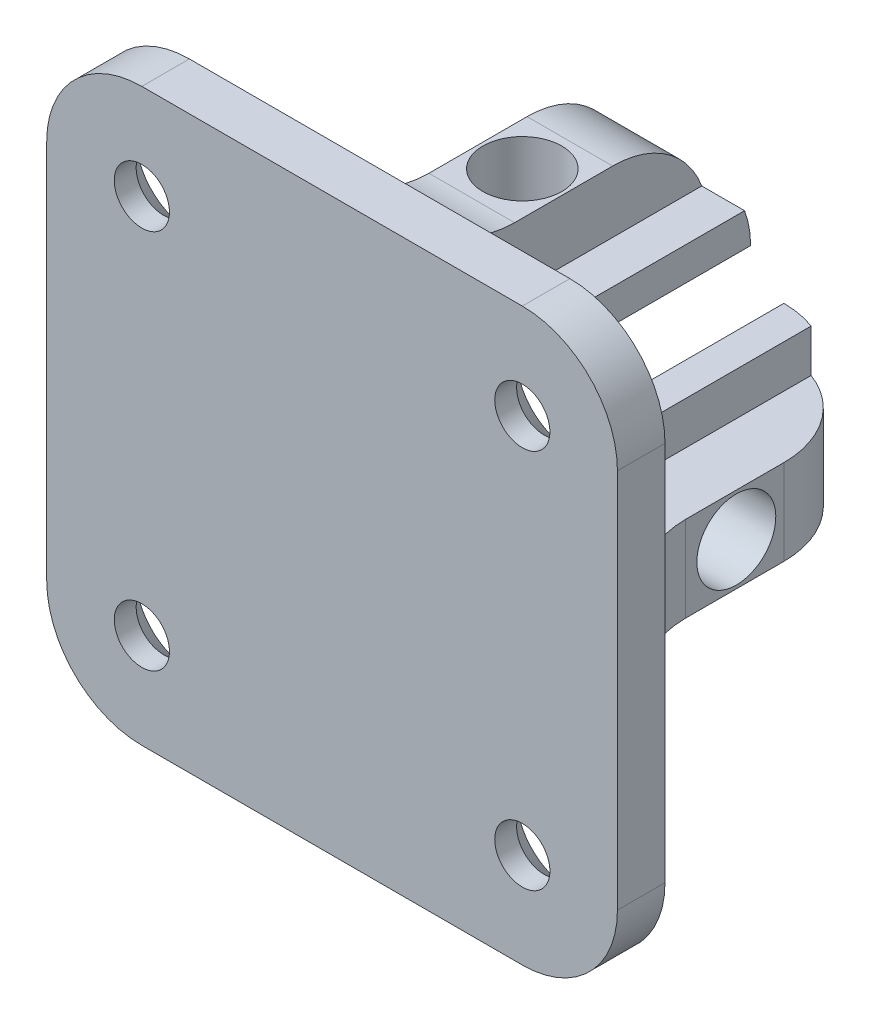
from build123d import *

# Parameters (mm, degrees)
SKETCH1_W                                            = 60
SKETCH1_H                                            = 60
BOSS_EXTRUDE1_DEPTH                                  = 5
CSK_FOR_M5_HEX_SOCKET_COUNTERSUNK_CAP_SC_D           = 5.8
CSK_FOR_M5_HEX_SOCKET_COUNTERSUNK_CAP_SC_DEPTH       = 5
CSK_FOR_M5_HEX_SOCKET_COUNTERSUNK_CAP_SC_CSINK_D     = 11.2
CSK_FOR_M5_HEX_SOCKET_COUNTERSUNK_CAP_SC_CSINK_ANGLE = 90
CSK_FOR_M5_HEX_SOCKET_COUNTERSUNK_CAP_SC_TIP         = 1.742495795
BOSS_EXTRUDE2_DEPTH                                  = 30
FILLET1_R                                            = 10
CUT_EXTRUDE1_REACH                                   = 73.553
SKETCH11_R                                           = 4.15
CIRPATTERN1_COUNT                                    = 4
FILLET2_R                                            = 10
CUT_EXTRUDE2_DEPTH                                   = 6.5
CIRPATTERN2_COUNT                                    = 4


with BuildPart() as part:
    # Sketch1 → Boss-Extrude1 (new body)
    with BuildSketch(Plane.XY):
        with Locations((-22.5, 22.5)):
            Rectangle(SKETCH1_W, SKETCH1_H)
    extrude(amount=BOSS_EXTRUDE1_DEPTH)

    # CSK for M5 Hex Socket Countersunk Cap Screw1
    with Locations(Plane(origin=(0, 0, 0), x_dir=(-1, 0, 0), z_dir=(0, 0, -1))):
        with Locations((2.5, 42.5), (42.5, 42.5), (42.5, 2.5), (2.5, 2.5)):
            CounterSinkHole(CSK_FOR_M5_HEX_SOCKET_COUNTERSUNK_CAP_SC_D / 2, CSK_FOR_M5_HEX_SOCKET_COUNTERSUNK_CAP_SC_CSINK_D / 2, depth=CSK_FOR_M5_HEX_SOCKET_COUNTERSUNK_CAP_SC_DEPTH, counter_sink_angle=CSK_FOR_M5_HEX_SOCKET_COUNTERSUNK_CAP_SC_CSINK_ANGLE)
            with Locations((0, 0, -(CSK_FOR_M5_HEX_SOCKET_COUNTERSUNK_CAP_SC_DEPTH + CSK_FOR_M5_HEX_SOCKET_COUNTERSUNK_CAP_SC_TIP / 2))):  # 118° drill point
                Cone(0, CSK_FOR_M5_HEX_SOCKET_COUNTERSUNK_CAP_SC_D / 2, CSK_FOR_M5_HEX_SOCKET_COUNTERSUNK_CAP_SC_TIP, mode=Mode.SUBTRACT)

    # Sketch8 → Boss-Extrude2 (add)
    with BuildSketch(Plane(origin=(0, 0, 0), x_dir=(-1, 0, 0), z_dir=(0, 0, -1))):
        Polygon((27, 0), (27, 6.5), (31.5, 6.5), (31.5, 10), (27.257359313, 14.242640687), (17.742640687, 14.242640687), (13.5, 10), (13.5, 6.5), (18, 6.5), (18, 0), align=None)
        Polygon((0, 18), (6.5, 18), (6.5, 13.5), (10, 13.5), (14.242640687, 17.742640687), (14.242640687, 27.257359313), (10, 31.5), (6.5, 31.5), (6.5, 27), (0, 27), align=None)
        Polygon((18, 45), (18, 38.5), (13.5, 38.5), (13.5, 35), (17.742640687, 30.757359313), (27.257359313, 30.757359313), (31.5, 35), (31.5, 38.5), (27, 38.5), (27, 45), align=None)
        Polygon((45, 27), (38.5, 27), (38.5, 31.5), (35, 31.5), (30.757359313, 27.257359313), (30.757359313, 17.742640687), (35, 13.5), (38.5, 13.5), (38.5, 18), (45, 18), align=None)
    extrude(amount=BOSS_EXTRUDE2_DEPTH)

    # Fillet1
    # the kernel refuses this fillet: 10 mm, written as the material it adds along each edge
    with BuildSketch(Plane(origin=(-27, 45, 0), x_dir=(0, 1, 0), z_dir=(1, 0, 0)), Plane(origin=(-45, 18, 0), x_dir=(-1, 0, 0), z_dir=(0, 1, 0)), Plane(origin=(0, 27, 0), x_dir=(1, 0, 0), z_dir=(0, -1, 0)), Plane(origin=(-18, 0, 0), x_dir=(0, -1, 0), z_dir=(-1, 0, 0))) as fillet1_piece_1:
        with BuildLine():
            CenterArc((10, -9.682458366), FILLET1_R, 104.477512186, 75.522487814)
            Line((0, -9.682458366), (0, 0))
            Line((0, 0), (7.5, 0))
        make_face()
    extrude(amount=9)
    # the kernel refuses this fillet: 10 mm, written as the material it takes off along each edge
    with BuildSketch(Plane(origin=(-52, 45, -30), x_dir=(0, -1, 0), z_dir=(1, 0, 0)), Plane(origin=(7, 0, -30), x_dir=(0, 1, 0), z_dir=(-1, 0, 0))) as fillet1_2_piece_1:
        with BuildLine():
            CenterArc((FILLET1_R, -FILLET1_R), FILLET1_R, 90, 90)
            Line((0, -FILLET1_R), (0, 0))
            Line((0, 0), (FILLET1_R, 0))
        make_face()
    extrude(amount=59, mode=Mode.SUBTRACT)
    with BuildSketch(Plane(origin=(-45, -7, -30), x_dir=(0, 0, 1), z_dir=(0, 1, 0)), Plane(origin=(0, 52, -30), x_dir=(0, 0, 1), z_dir=(0, -1, 0))) as fillet1_2_piece_2:
        with BuildLine():
            CenterArc((FILLET1_R, FILLET1_R), FILLET1_R, 180, 90)
            Line((0, FILLET1_R), (0, 0))
            Line((0, 0), (FILLET1_R, 0))
        make_face()
    extrude(amount=59, mode=Mode.SUBTRACT)

    # Sketch11 → Cut-Extrude1 (cut, up to next)
    with BuildSketch(Plane(origin=(0, 14.242640687, 0), x_dir=(1, 0, 0), z_dir=(0, 1, 0)), mode=Mode.PRIVATE) as cut_extrude1_sk1:
        with Locations(Location((-22.5, 15, 0), (0, 0, 180))):
            Circle(SKETCH11_R)
    cut_extrude1_tool1 = extrude(cut_extrude1_sk1.sketch, amount=-CUT_EXTRUDE1_REACH, mode=Mode.PRIVATE) & part.part
    cut_extrude1 = cut_extrude1_tool1.solids().sort_by_distance((-22.5, 14.242641, -15))[0]
    add(cut_extrude1, mode=Mode.SUBTRACT)

    # CirPattern1: Cut-Extrude1 ×4 about axis
    cirpattern1_axis = Axis((-22.5, 22.5, 0), (0, 0, -1))
    for i in range(1, CIRPATTERN1_COUNT):
        add(cut_extrude1.rotate(cirpattern1_axis, i * 360 / CIRPATTERN1_COUNT), mode=Mode.SUBTRACT)

    # Fillet2
    fillet2_edges = [part.edges().sort_by_distance(p)[0] for p in [
        (7.5, 52.5, 2.5),
        (7.5, -7.5, 2.5),
        (-52.5, -7.5, 2.5),
        (-52.5, 52.5, 2.5),
    ]]
    fillet(fillet2_edges, radius=FILLET2_R)

    # Sketch12 → Cut-Extrude2 (cut)
    with BuildSketch(Plane(origin=(-30.757359313, 0, 0), x_dir=(0, 0, -1), z_dir=(1, 0, 0))):
        Polygon((11.102885683, 15.75), (18.897114317, 15.75), (22.794228634, 22.5), (18.897114317, 29.25), (11.102885683, 29.25), (7.205771366, 22.5), align=None)
    cut_extrude2 = extrude(amount=-CUT_EXTRUDE2_DEPTH, mode=Mode.SUBTRACT)

    # CirPattern2: Cut-Extrude2 ×4 about axis
    cirpattern2_axis = Axis((-22.5, 22.5, 0), (0, 0, 1))
    for i in range(1, CIRPATTERN2_COUNT):
        add(cut_extrude2.rotate(cirpattern2_axis, i * 360 / CIRPATTERN2_COUNT), mode=Mode.SUBTRACT)


solid = part.part
